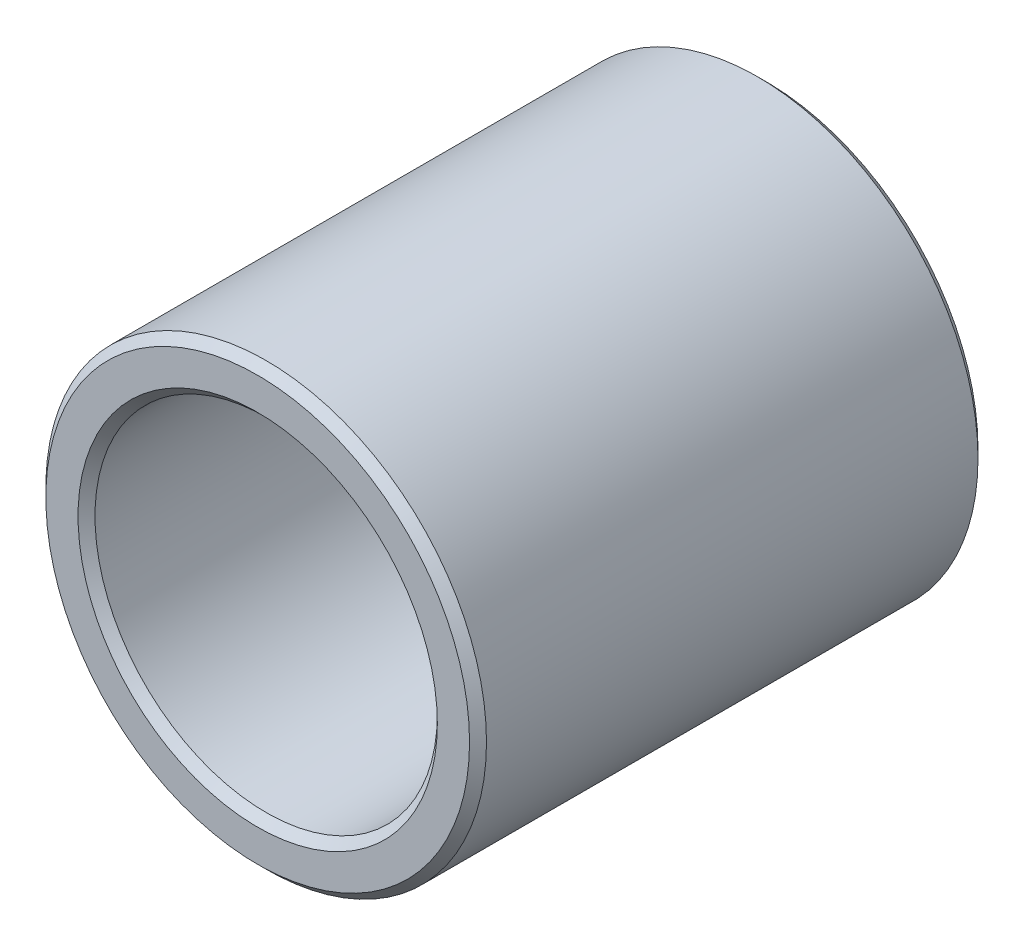
from build123d import *

# Parameters (mm, degrees)
SKETCH1_R           = 6.5
SKETCH1_R_2         = 5.05
BOSS_EXTRUDE1_DEPTH = 15
CHAMFER1_SIZE       = 0.25


with BuildPart() as part:
    # Sketch1 → Boss-Extrude1 (new body)
    with BuildSketch(Plane.XY):
        Circle(SKETCH1_R)
        Circle(SKETCH1_R_2, mode=Mode.SUBTRACT)
    extrude(amount=BOSS_EXTRUDE1_DEPTH)

    # Chamfer1
    chamfer1_edges = [part.edges().sort_by_distance(p)[0] for p in [
        (-5.05, 0, 15),
        (-6.5, 0, 15),
        (-5.05, 0, 0),
        (-6.5, 0, 0),
    ]]
    chamfer(chamfer1_edges, length=CHAMFER1_SIZE)


solid = part.part
